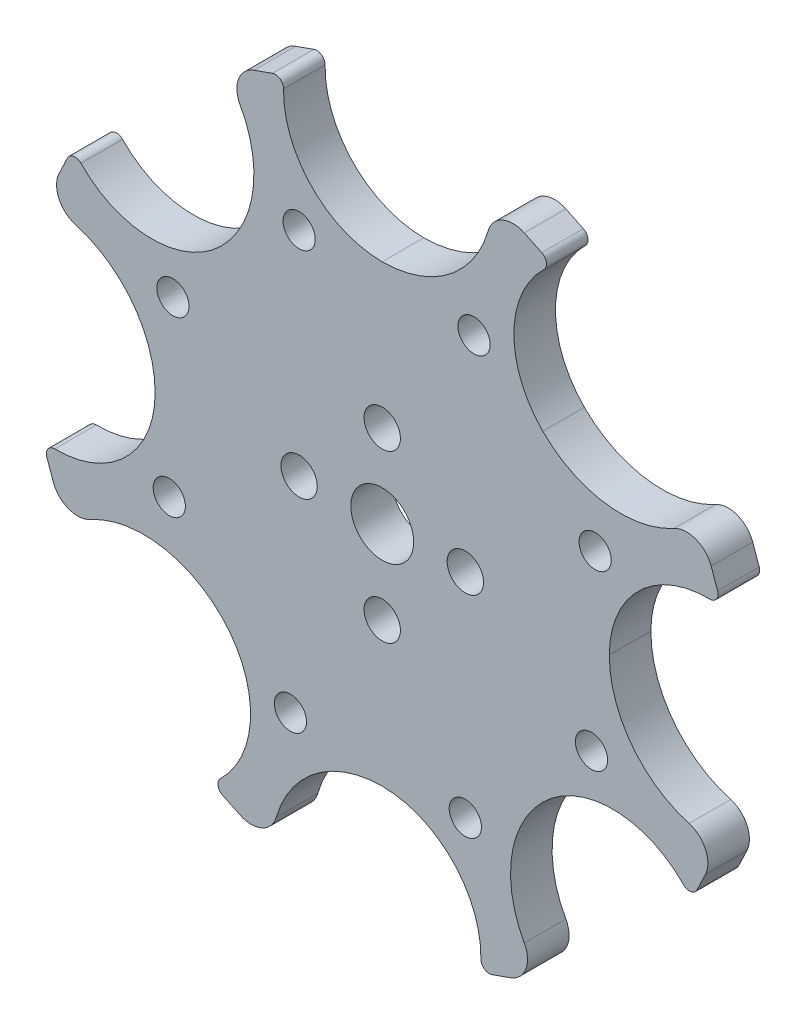
from build123d import *

# Parameters (mm, degrees)
SKETCH_1_R          = 3.025
SKETCH_1_R_2        = 1.75
EXTRUDE_1_DEPTH     = 4
SKETCH_2_R          = 1.55
CUT_EXTRUDE_1_DEPTH = 10


with BuildPart() as part:
    # 草图1 → 凸台-拉伸1 (new body)
    with BuildSketch(Plane.XY):
        with BuildLine():
            Line((15.356969673, 30.298929166), (13.674015522, 31.101791788))
            ThreePointArc((13.674015522, 31.101791788), (11.571454033, 31.125101256), (10.194791162, 29.535727958))
            ThreePointArc((10.194791162, 29.535727958), (6.381394442, 23.991783581), (0, 21.857511157))
            ThreePointArc((0, 21.857511157), (-6.773355282, 24.696305694), (-9.498676044, 31.516109427))
            ThreePointArc((-9.498676044, 31.516109427), (-9.831389744, 32.178886119), (-10.565560882, 32.28359567))
            Line((-10.565560882, 32.28359567), (-12.323298779, 31.661276982))
            ThreePointArc((-12.323298779, 31.661276982), (-13.826516548, 30.191023779), (-13.676107562, 28.09371949))
            ThreePointArc((-13.676107562, 28.09371949), (-12.45242558, 21.477080146), (-15.455594359, 15.455594359))
            ThreePointArc((-15.455594359, 15.455594359), (-22.252410678, 12.673439775), (-29.001832935, 15.568676449))
            ThreePointArc((-29.001832935, 15.568676449), (-29.705750942, 15.802066229), (-30.298929166, 15.356969673))
            Line((-30.298929166, 15.356969673), (-31.101791788, 13.674015522))
            ThreePointArc((-31.101791788, 13.674015522), (-31.125101256, 11.571454033), (-29.535727958, 10.194791162))
            ThreePointArc((-29.535727958, 10.194791162), (-23.991783581, 6.381394442), (-21.857511157, 0))
            ThreePointArc((-21.857511157, 0), (-24.696305694, -6.773355282), (-31.516109427, -9.498676044))
            ThreePointArc((-31.516109427, -9.498676044), (-32.178886119, -9.831389744), (-32.28359567, -10.565560882))
            Line((-32.28359567, -10.565560882), (-31.661276982, -12.323298779))
            ThreePointArc((-31.661276982, -12.323298779), (-30.191023779, -13.826516548), (-28.09371949, -13.676107562))
            ThreePointArc((-28.09371949, -13.676107562), (-21.477080146, -12.45242558), (-15.455594359, -15.455594359))
            ThreePointArc((-15.455594359, -15.455594359), (-12.673439775, -22.252410678), (-15.568676449, -29.001832935))
            ThreePointArc((-15.568676449, -29.001832935), (-15.802066229, -29.705750942), (-15.356969673, -30.298929166))
            Line((-15.356969673, -30.298929166), (-13.674015522, -31.101791788))
            ThreePointArc((-13.674015522, -31.101791788), (-11.571454033, -31.125101256), (-10.194791162, -29.535727958))
            ThreePointArc((-10.194791162, -29.535727958), (-6.381394442, -23.991783581), (0, -21.857511157))
            ThreePointArc((0, -21.857511157), (6.773355282, -24.696305694), (9.498676044, -31.516109427))
            ThreePointArc((9.498676044, -31.516109427), (9.831389744, -32.178886119), (10.565560882, -32.28359567))
            Line((10.565560882, -32.28359567), (12.323298779, -31.661276982))
            ThreePointArc((12.323298779, -31.661276982), (13.826516548, -30.191023779), (13.676107562, -28.09371949))
            ThreePointArc((13.676107562, -28.09371949), (12.45242558, -21.477080146), (15.455594359, -15.455594359))
            ThreePointArc((15.455594359, -15.455594359), (22.252410678, -12.673439775), (29.001832935, -15.568676449))
            ThreePointArc((29.001832935, -15.568676449), (29.705750942, -15.802066229), (30.298929166, -15.356969673))
            Line((30.298929166, -15.356969673), (31.101791788, -13.674015522))
            ThreePointArc((31.101791788, -13.674015522), (31.125101256, -11.571454033), (29.535727958, -10.194791162))
            ThreePointArc((29.535727958, -10.194791162), (23.991783581, -6.381394442), (21.857511157, 0))
            ThreePointArc((21.857511157, 0), (24.696305694, 6.773355282), (31.516109427, 9.498676044))
            ThreePointArc((31.516109427, 9.498676044), (32.178886119, 9.831389744), (32.28359567, 10.565560882))
            Line((32.28359567, 10.565560882), (31.661276982, 12.323298779))
            ThreePointArc((31.661276982, 12.323298779), (30.191023779, 13.826516548), (28.09371949, 13.676107562))
            ThreePointArc((28.09371949, 13.676107562), (21.477080146, 12.45242558), (15.455594359, 15.455594359))
            ThreePointArc((15.455594359, 15.455594359), (12.673439775, 22.252410678), (15.568676449, 29.001832935))
            ThreePointArc((15.568676449, 29.001832935), (15.802066229, 29.705750942), (15.356969673, 30.298929166))
        make_face()
        Circle(SKETCH_1_R, mode=Mode.SUBTRACT)
        with Locations((-8, 0)):
            Circle(SKETCH_1_R_2, mode=Mode.SUBTRACT)
        with Locations((0, 8)):
            Circle(SKETCH_1_R_2, mode=Mode.SUBTRACT)
        with Locations((8, 0)):
            Circle(SKETCH_1_R_2, mode=Mode.SUBTRACT)
        with Locations((0, -8)):
            Circle(SKETCH_1_R_2, mode=Mode.SUBTRACT)
    extrude(amount=EXTRUDE_1_DEPTH)

    # 草图2 → 切除-拉伸1 (cut)
    with BuildSketch(Plane.XY.offset(4)):
        with Locations((8.83809202, 20.146665467)):
            Circle(SKETCH_2_R)
        with Locations((-8.83809202, -20.146665467)):
            Circle(SKETCH_2_R)
        with Locations((20.49531857, 7.99636897)):
            Circle(SKETCH_2_R)
        with Locations((20.146665467, -8.83809202)):
            Circle(SKETCH_2_R)
        with Locations((7.99636897, -20.49531857)):
            Circle(SKETCH_2_R)
        with Locations((-20.49531857, -7.99636897)):
            Circle(SKETCH_2_R)
        with Locations((-20.146665467, 8.83809202)):
            Circle(SKETCH_2_R)
        with Locations((-7.99636897, 20.49531857)):
            Circle(SKETCH_2_R)
    extrude(amount=-CUT_EXTRUDE_1_DEPTH, mode=Mode.SUBTRACT)


solid = part.part
